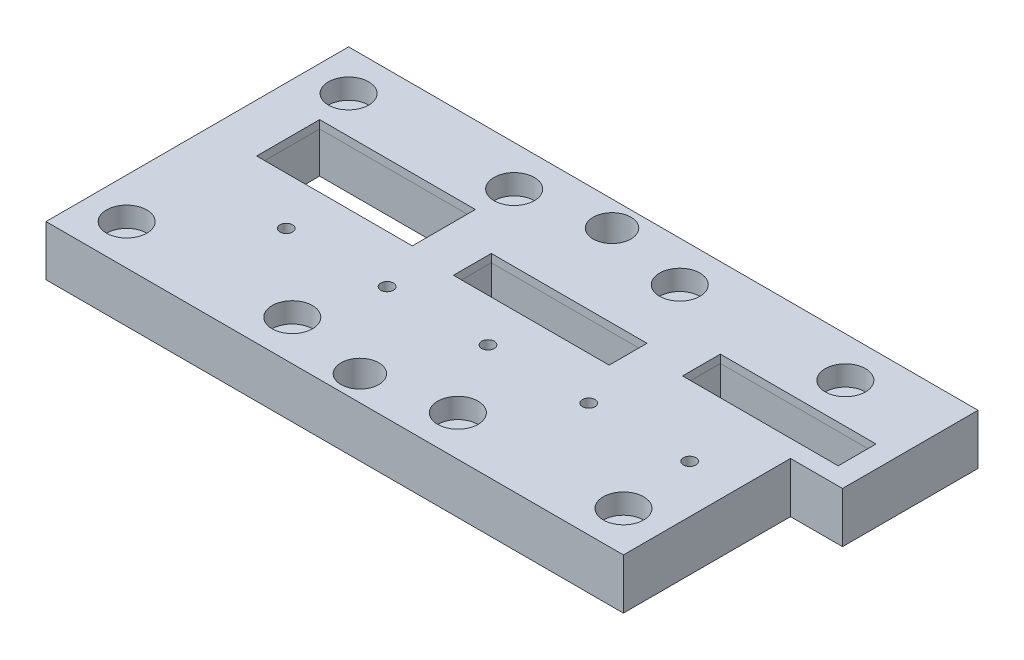
from build123d import *

# Parameters (mm, degrees)
SKETCH1_W            = 229
SKETCH1_H            = 120
BOSS_EXTRUDE1_DEPTH  = 10
SKETCH4_W            = 20.632503002
SKETCH4_H            = 53.730004003
BOSS_EXTRUDE2_DEPTH  = 20
CUT_EXTRUDE1_REACH   = 239.573
SKETCH5_W            = 61.75
SKETCH5_H            = 15
SKETCH5_H_2          = 25
CUT_EXTRUDE2_REACH   = 239.573
SKETCH6_R            = 2.5
CUT_EXTRUDE3_REACH   = 239.573
SKETCH7_R            = 7.5
SKETCH8_R            = 8
CUT_EXTRUDE4_DEPTH   = 8
LPATTERN2_COUNT      = 4
LPATTERN2_PITCH      = 65.677
LPATTERN2_COUNT_DIR2 = 2
LPATTERN2_PITCH_DIR2 = 88
M6_TAPPED_HOLE2_D    = 5


with BuildPart() as part:
    # Sketch1 → Boss-Extrude1 (new, symmetric)
    with BuildSketch(Plane(origin=(0, 0, 0), x_dir=(1, 0, 0), z_dir=(0, 1, 0))):
        with Locations((-114.5, 0)):
            Rectangle(SKETCH1_W, SKETCH1_H)
    extrude(amount=BOSS_EXTRUDE1_DEPTH, both=True)

    # Sketch4 → Boss-Extrude2 (add)
    with BuildSketch(Plane(origin=(0, 10, 0), x_dir=(1, 0, 0), z_dir=(0, 1, 0))):
        with Locations((10.316251501, 33.134997999)):
            Rectangle(SKETCH4_W, SKETCH4_H)
    extrude(amount=-BOSS_EXTRUDE2_DEPTH)

    # Sketch5 → Cut-Extrude1 (cut, up to next)
    with BuildSketch(Plane(origin=(0, 10, 0), x_dir=(1, 0, 0), z_dir=(0, 1, 0)), mode=Mode.PRIVATE) as cut_extrude1_sk1:
        with Locations((-98.875, 9.852366083)):
            Rectangle(SKETCH5_W, SKETCH5_H)
    cut_extrude1_tool1 = extrude(cut_extrude1_sk1.sketch, amount=-CUT_EXTRUDE1_REACH, mode=Mode.PRIVATE) & part.part
    # Sketch5 → Cut-Extrude1 (cut, up to next)
    with BuildSketch(Plane(origin=(0, 10, 0), x_dir=(1, 0, 0), z_dir=(0, 1, 0)), mode=Mode.PRIVATE) as cut_extrude1_sk2:
        with Locations((-18.875, 20.69101)):
            Rectangle(SKETCH5_W, SKETCH5_H)
    cut_extrude1_tool2 = extrude(cut_extrude1_sk2.sketch, amount=-CUT_EXTRUDE1_REACH, mode=Mode.PRIVATE) & part.part
    # Sketch5 → Cut-Extrude1 (cut, up to next)
    with BuildSketch(Plane(origin=(0, 10, 0), x_dir=(1, 0, 0), z_dir=(0, 1, 0)), mode=Mode.PRIVATE) as cut_extrude1_sk3:
        with Locations((-178.875, 16.78)):
            Rectangle(SKETCH5_W, SKETCH5_H_2)
    cut_extrude1_tool3 = extrude(cut_extrude1_sk3.sketch, amount=-CUT_EXTRUDE1_REACH, mode=Mode.PRIVATE) & part.part
    add(cut_extrude1_tool1.solids().sort_by_distance((-98.875, 10, -9.852366))[0], mode=Mode.SUBTRACT)
    add(cut_extrude1_tool2.solids().sort_by_distance((-18.875, 10, -20.69101))[0], mode=Mode.SUBTRACT)
    add(cut_extrude1_tool3.solids().sort_by_distance((-178.875, 10, -16.78))[0], mode=Mode.SUBTRACT)

    # Sketch6 → Cut-Extrude2 (cut, up to next)
    with BuildSketch(Plane(origin=(0, 10, 0), x_dir=(1, 0, 0), z_dir=(0, 1, 0)), mode=Mode.PRIVATE) as cut_extrude2_sk1:
        with Locations(Location((-179, -14.72, 0), (0, 0, 270))):
            Circle(SKETCH6_R)
    cut_extrude2_tool1 = extrude(cut_extrude2_sk1.sketch, amount=-CUT_EXTRUDE2_REACH, mode=Mode.PRIVATE) & part.part
    # Sketch6 → Cut-Extrude2 (cut, up to next)
    with BuildSketch(Plane(origin=(0, 10, 0), x_dir=(1, 0, 0), z_dir=(0, 1, 0)), mode=Mode.PRIVATE) as cut_extrude2_sk2:
        with Locations(Location((-139, -14.72, 0), (0, 0, 270))):
            Circle(SKETCH6_R)
    cut_extrude2_tool2 = extrude(cut_extrude2_sk2.sketch, amount=-CUT_EXTRUDE2_REACH, mode=Mode.PRIVATE) & part.part
    # Sketch6 → Cut-Extrude2 (cut, up to next)
    with BuildSketch(Plane(origin=(0, 10, 0), x_dir=(1, 0, 0), z_dir=(0, 1, 0)), mode=Mode.PRIVATE) as cut_extrude2_sk3:
        with Locations(Location((-99, -14.72, 0), (0, 0, 270))):
            Circle(SKETCH6_R)
    cut_extrude2_tool3 = extrude(cut_extrude2_sk3.sketch, amount=-CUT_EXTRUDE2_REACH, mode=Mode.PRIVATE) & part.part
    # Sketch6 → Cut-Extrude2 (cut, up to next)
    with BuildSketch(Plane(origin=(0, 10, 0), x_dir=(1, 0, 0), z_dir=(0, 1, 0)), mode=Mode.PRIVATE) as cut_extrude2_sk4:
        with Locations(Location((-59, -14.72, 0), (0, 0, 270))):
            Circle(SKETCH6_R)
    cut_extrude2_tool4 = extrude(cut_extrude2_sk4.sketch, amount=-CUT_EXTRUDE2_REACH, mode=Mode.PRIVATE) & part.part
    # Sketch6 → Cut-Extrude2 (cut, up to next)
    with BuildSketch(Plane(origin=(0, 10, 0), x_dir=(1, 0, 0), z_dir=(0, 1, 0)), mode=Mode.PRIVATE) as cut_extrude2_sk5:
        with Locations(Location((-19, -14.72, 0), (0, 0, 270))):
            Circle(SKETCH6_R)
    cut_extrude2_tool5 = extrude(cut_extrude2_sk5.sketch, amount=-CUT_EXTRUDE2_REACH, mode=Mode.PRIVATE) & part.part
    add(cut_extrude2_tool1.solids().sort_by_distance((-179, 10, 14.72))[0], mode=Mode.SUBTRACT)
    add(cut_extrude2_tool2.solids().sort_by_distance((-139, 10, 14.72))[0], mode=Mode.SUBTRACT)
    add(cut_extrude2_tool3.solids().sort_by_distance((-99, 10, 14.72))[0], mode=Mode.SUBTRACT)
    add(cut_extrude2_tool4.solids().sort_by_distance((-59, 10, 14.72))[0], mode=Mode.SUBTRACT)
    add(cut_extrude2_tool5.solids().sort_by_distance((-19, 10, 14.72))[0], mode=Mode.SUBTRACT)

    # Sketch7 → Cut-Extrude3 (cut, up to next)
    with BuildSketch(Plane(origin=(0, 10, 0), x_dir=(1, 0, 0), z_dir=(0, 1, 0)), mode=Mode.PRIVATE) as cut_extrude3_sk1:
        with Locations(Location((-114.5, 50, 0), (0, 0, 270))):
            Circle(SKETCH7_R)
    cut_extrude3_tool1 = extrude(cut_extrude3_sk1.sketch, amount=-CUT_EXTRUDE3_REACH, mode=Mode.PRIVATE) & part.part
    # Sketch7 → Cut-Extrude3 (cut, up to next)
    with BuildSketch(Plane(origin=(0, 10, 0), x_dir=(1, 0, 0), z_dir=(0, 1, 0)), mode=Mode.PRIVATE) as cut_extrude3_sk2:
        with Locations(Location((-114.5, -50, 0), (0, 0, 270))):
            Circle(SKETCH7_R)
    cut_extrude3_tool2 = extrude(cut_extrude3_sk2.sketch, amount=-CUT_EXTRUDE3_REACH, mode=Mode.PRIVATE) & part.part
    add(cut_extrude3_tool1.solids().sort_by_distance((-114.5, 10, -50))[0], mode=Mode.SUBTRACT)
    add(cut_extrude3_tool2.solids().sort_by_distance((-114.5, 10, 50))[0], mode=Mode.SUBTRACT)

    # Draft1: read off the stored shape, not the designer's step
    # Draft1: loft between two sections, ruled curve by curve
    draft1_from = [
        Edge.make_line((-129.75, 6.8, -17.352366083), (-129.75, 6.8, -2.352366083)),
        Edge.make_line((-68, 6.8, -17.352366083), (-129.75, 6.8, -17.352366083)),
        Edge.make_line((-68, 6.8, -2.352366083), (-68, 6.8, -17.352366083)),
        Edge.make_line((-129.75, 6.8, -2.352366083), (-68, 6.8, -2.352366083)),
    ]
    draft1_to = [
        Edge.make_line((-130.336668927, -10, -17.93903501), (-130.336668927, -10, -1.765697156)),
        Edge.make_line((-67.413331073, -10, -17.93903501), (-130.336668927, -10, -17.93903501)),
        Edge.make_line((-67.413331073, -10, -1.765697156), (-67.413331073, -10, -17.93903501)),
        Edge.make_line((-130.336668927, -10, -1.765697156), (-67.413331073, -10, -1.765697156)),
    ]
    draft1 = Solid(Shell([*[Face.make_surface_from_curves(draft1_from[k], draft1_to[k]) for k in range(4)], Face(Wire(draft1_from)), Face(Wire(draft1_to))]))
    add(draft1, mode=Mode.SUBTRACT)

    # Draft1 2: loft between two sections, ruled curve by curve
    draft1_2_from = [
        Edge.make_line((-49.75, 6.8, -28.19101), (-49.75, 6.8, -13.19101)),
        Edge.make_line((12, 6.8, -28.19101), (-49.75, 6.8, -28.19101)),
        Edge.make_line((12, 6.8, -13.19101), (12, 6.8, -28.19101)),
        Edge.make_line((-49.75, 6.8, -13.19101), (12, 6.8, -13.19101)),
    ]
    draft1_2_to = [
        Edge.make_line((-50.336668927, -10, -28.777678927), (-50.336668927, -10, -12.604341073)),
        Edge.make_line((12.586668927, -10, -28.777678927), (-50.336668927, -10, -28.777678927)),
        Edge.make_line((12.586668927, -10, -12.604341073), (12.586668927, -10, -28.777678927)),
        Edge.make_line((-50.336668927, -10, -12.604341073), (12.586668927, -10, -12.604341073)),
    ]
    draft1_2 = Solid(Shell([*[Face.make_surface_from_curves(draft1_2_from[k], draft1_2_to[k]) for k in range(4)], Face(Wire(draft1_2_from)), Face(Wire(draft1_2_to))]))
    add(draft1_2, mode=Mode.SUBTRACT)

    # Draft1 3: loft between two sections, ruled curve by curve
    draft1_3_from = [
        Edge.make_line((-209.75, 6.8, -29.28), (-209.75, 6.8, -4.28)),
        Edge.make_line((-148, 6.8, -29.28), (-209.75, 6.8, -29.28)),
        Edge.make_line((-148, 6.8, -4.28), (-148, 6.8, -29.28)),
        Edge.make_line((-209.75, 6.8, -4.28), (-148, 6.8, -4.28)),
    ]
    draft1_3_to = [
        Edge.make_line((-210.336668927, -10, -29.866668927), (-210.336668927, -10, -3.693331073)),
        Edge.make_line((-147.413331073, -10, -29.866668927), (-210.336668927, -10, -29.866668927)),
        Edge.make_line((-147.413331073, -10, -3.693331073), (-147.413331073, -10, -29.866668927)),
        Edge.make_line((-210.336668927, -10, -3.693331073), (-147.413331073, -10, -3.693331073)),
    ]
    draft1_3 = Solid(Shell([*[Face.make_surface_from_curves(draft1_3_from[k], draft1_3_to[k]) for k in range(4)], Face(Wire(draft1_3_from)), Face(Wire(draft1_3_to))]))
    add(draft1_3, mode=Mode.SUBTRACT)

    # Sketch8 → Cut-Extrude4 (cut)
    with BuildSketch(Plane(origin=(0, 10, 0), x_dir=(1, 0, 0), z_dir=(0, 1, 0))):
        with Locations(Location((-213, 44, 0), (0, 0, 270))):
            Circle(SKETCH8_R)
    cut_extrude4 = extrude(amount=-CUT_EXTRUDE4_DEPTH, mode=Mode.SUBTRACT)

    # LPattern2: Cut-Extrude4 4 × 2
    with Locations(*[(i * LPATTERN2_PITCH, 0, j * LPATTERN2_PITCH_DIR2) for i in range(LPATTERN2_COUNT) for j in range(LPATTERN2_COUNT_DIR2) if (i, j) != (0, 0)]):
        add(cut_extrude4, mode=Mode.SUBTRACT)

    # M6 Tapped Hole2 (through all)
    with Locations(Plane(origin=(0, 2, 0), x_dir=(1, 0, 0), z_dir=(0, 1, 0))):
        with Locations((-213, 44), (-15.969, 44), (-15.969, -44), (-213, -44)):
            Hole(M6_TAPPED_HOLE2_D / 2)


solid = part.part
